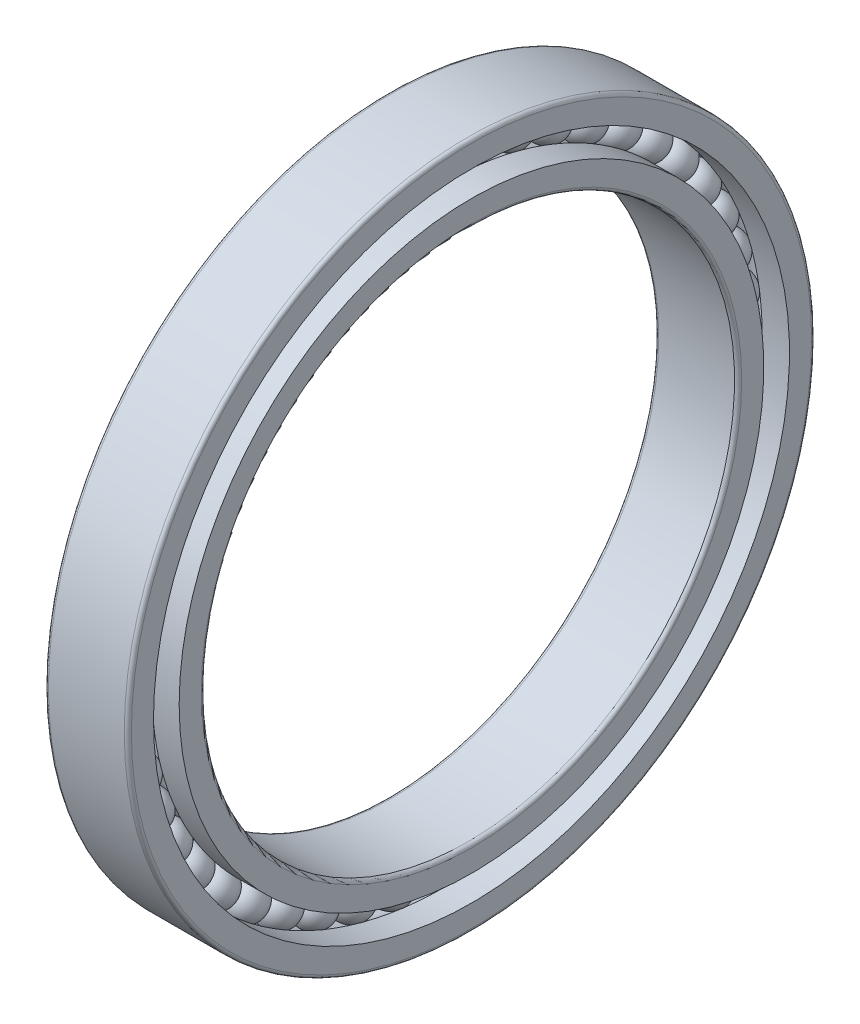
from build123d import *

# Parameters (mm, degrees)
CIRCULAR_PATTERN1_COUNT = 48
FILLET1_R               = 0.3


with BuildPart() as part:
    # Sketch1 → Revolve1 (revolve)
    with BuildSketch(Plane.XY):
        with BuildLine():
            Line((-1.625, 25.75), (1.625, 25.75))
            ThreePointArc((1.625, 25.75), (0, 27.375), (-1.625, 25.75))
        make_face()
    revolve1 = revolve(axis=Axis((-4.596601835, 25.75, 0), (1, 0, 0)))

    # Sketch2 → Revolve2 (revolve)
    with BuildSketch(Plane.XY):
        with BuildLine():
            Line((-3.5, 24.666666667), (-3.5, 22.5))
            Line((-3.5, 22.5), (3.5, 22.5))
            Line((3.5, 22.5), (3.5, 24.666666667))
            Line((3.5, 24.666666667), (1.197753685, 24.666666667))
            ThreePointArc((1.197753685, 24.666666667), (0, 24.135), (-1.197753685, 24.666666667))
            Line((-1.197753685, 24.666666667), (-3.5, 24.666666667))
        make_face()
    revolve(axis=Axis((-6.971390126, 0, 0), (1, 0, 0)))

    # Sketch3 → Revolve3 (revolve)
    with BuildSketch(Plane.XY):
        with BuildLine():
            Line((-3.5, 29), (3.5, 29))
            Line((3.5, 29), (3.5, 26.833333333))
            Line((3.5, 26.833333333), (1.197753685, 26.833333333))
            ThreePointArc((1.197753685, 26.833333333), (0, 27.365), (-1.197753685, 26.833333333))
            Line((-1.197753685, 26.833333333), (-3.5, 26.833333333))
            Line((-3.5, 26.833333333), (-3.5, 29))
        make_face()
    revolve(axis=Axis((-8.710676495, 0, 0), (1, 0, 0)))

    # Circular-Pattern1: Revolve1 ×48 about axis
    circular_pattern1_axis = Axis((-6.971390126, 0, 0), (1, 0, 0))
    for i in range(1, CIRCULAR_PATTERN1_COUNT):
        add(revolve1.rotate(circular_pattern1_axis, i * 360 / CIRCULAR_PATTERN1_COUNT))

    # Fillet1
    fillet1_edges = [part.edges().sort_by_distance(p)[0] for p in [
        (-3.5, -22.5, 0),
        (-3.5, -29, 0),
        (3.5, -29, 0),
        (3.5, -22.5, 0),
    ]]
    fillet(fillet1_edges, radius=FILLET1_R)


solid = part.part
